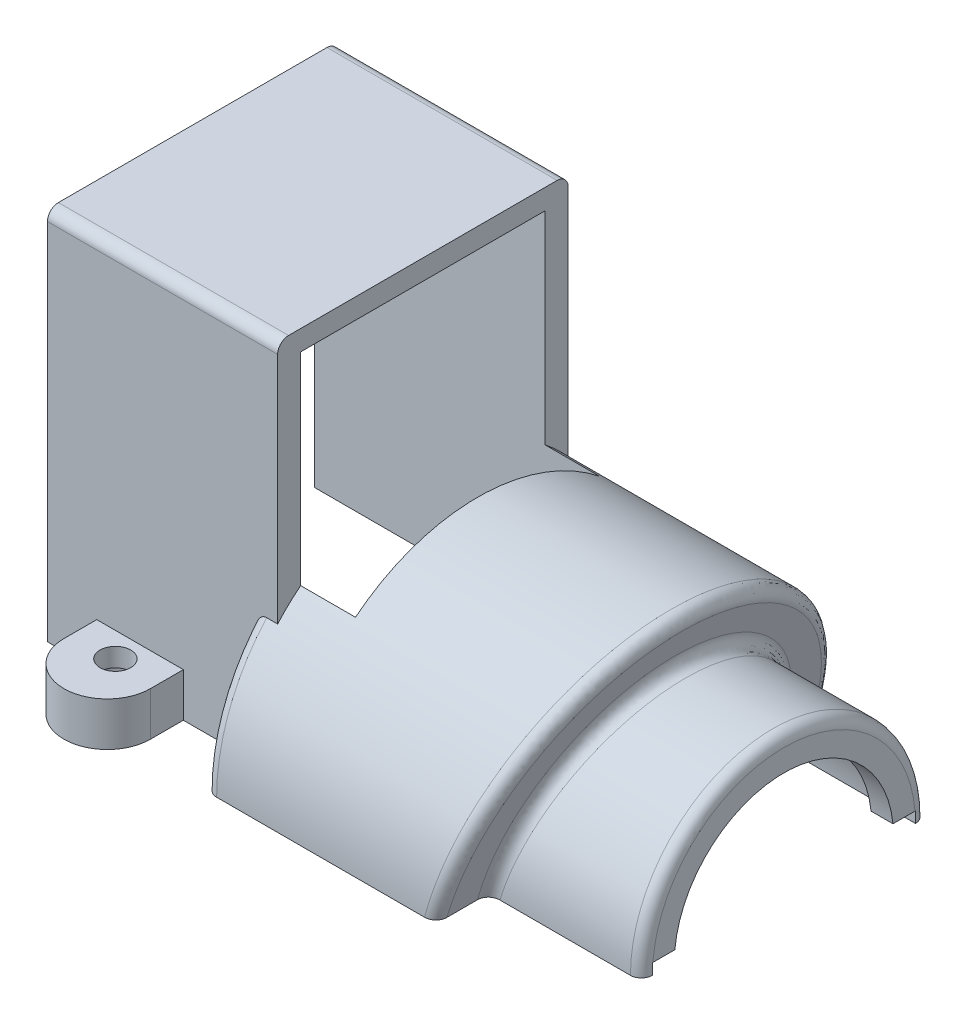
from build123d import *

# Parameters (mm, degrees)
ESQUISSE1_W                                       = 21.5
ESQUISSE1_H                                       = 34.2
EXTRUSION1_DEPTH                                  = 26.5
ESQUISSE2_W                                       = 22.27
ESQUISSE2_H                                       = 32.35
ENL_V_MAT_EXTRU_1_DEPTH                           = 49.312938226
EXTRUSION2_DEPTH                                  = 4
CHAMBRAGE_POUR_VIS_T_TE_HEXAGONALE_M2_D           = 2.8
CHAMBRAGE_POUR_VIS_T_TE_HEXAGONALE_M2_DEPTH       = 10.8185
CHAMBRAGE_POUR_VIS_T_TE_HEXAGONALE_M2_CBORE_D     = 5
CHAMBRAGE_POUR_VIS_T_TE_HEXAGONALE_M2_CBORE_DEPTH = 2.3
CHAMBRAGE_POUR_VIS_T_TE_HEXAGONALE_M2_TIP         = 0.841204867
CONG_1_R                                          = 1
EXTRUSION3_DEPTH                                  = 24
EXTRUSION3_DEPTH_BACK                             = 2
ENL_V_MAT_EXTRU_2_DEPTH                           = 24
ENL_V_MAT_EXTRU_3_DEPTH                           = 7
ENL_V_MAT_EXTRU_5_DEPTH                           = 67.021151914
ENL_V_MAT_EXTRU_5_DEPTH_BACK                      = 67.021151914
EXTRUSION4_START                                  = -1
EXTRUSION4_DEPTH                                  = 5.297752809
EXTRUSION4_START_2                                = 38.99092925
EXTRUSION4_2_OUTLINE_W                            = 19
EXTRUSION4_2_OUTLINE_H                            = 34
EXTRUSION4_2_DEPTH                                = 5.00907075
EXTRUSION5_DEPTH                                  = 13.95
ENL_V_MAT_EXTRU_6_DEPTH                           = 13.95
CONG_4_R                                          = 1
EXTRUSION7_REACH                                  = 74.48
EXTRUSION7_END_RADIUS                             = 15.3
ESQUISSE15_R                                      = 2.5
EXTRUSION7_DIRECTION_2_DEPTH                      = 1.5
ESQUISSE16_R                                      = 1.15
ENL_V_MAT_EXTRU_7_DEPTH                           = 10
EXTRUSION9_DEPTH                                  = 2
EXTRUSION11_DEPTH                                 = 2
CONG_6_R                                          = 1
ENL_V_MAT_EXTRU_10_DEPTH                          = 1
ESQUISSE20_W                                      = 1.651458657
ESQUISSE20_H                                      = 29.200791705
ENL_V_MAT_EXTRU_11_DEPTH                          = 74.199692791


with BuildPart() as part:
    # Esquisse1 → Extrusion1 (new body)
    with BuildSketch(Plane.XY):
        with Locations((10.75, 17.1)):
            Rectangle(ESQUISSE1_W, ESQUISSE1_H)
    extrude(amount=EXTRUSION1_DEPTH)

    # Esquisse2 → Enlèv. mat.-Extru.1 (cut, through all)
    with BuildSketch(Plane.ZY):
        with Locations((13.265, 16.175)):
            Rectangle(ESQUISSE2_W, ESQUISSE2_H)
    extrude(amount=-ENL_V_MAT_EXTRU_1_DEPTH, mode=Mode.SUBTRACT)

    # Esquisse3 → Extrusion2 (add)
    with BuildSketch(Plane.XZ):
        with BuildLine():
            Line((12.9, 26.5), (5, 26.5))
            Line((5, 26.5), (5, 29.5))
            ThreePointArc((5, 29.5), (8.95, 33.45), (12.9, 29.5))
            Line((12.9, 29.5), (12.9, 26.5))
        make_face()
        with BuildLine():
            Line((12.9, 0.03), (5, 0.03))
            Line((5, 0.03), (5, -2.97))
            ThreePointArc((5, -2.97), (8.95, -6.92), (12.9, -2.97))
            Line((12.9, -2.97), (12.9, 0.03))
        make_face()
    extrude(amount=-EXTRUSION2_DEPTH)

    # Chambrage pour vis à tête hexagonale M2.51
    with Locations(Plane.XZ):
        with Locations((8.95, 28.75), (8.95, -2.25)):
            CounterBoreHole(CHAMBRAGE_POUR_VIS_T_TE_HEXAGONALE_M2_D / 2, CHAMBRAGE_POUR_VIS_T_TE_HEXAGONALE_M2_CBORE_D / 2, CHAMBRAGE_POUR_VIS_T_TE_HEXAGONALE_M2_CBORE_DEPTH, depth=CHAMBRAGE_POUR_VIS_T_TE_HEXAGONALE_M2_DEPTH)
            with Locations((0, 0, -(CHAMBRAGE_POUR_VIS_T_TE_HEXAGONALE_M2_DEPTH + CHAMBRAGE_POUR_VIS_T_TE_HEXAGONALE_M2_TIP / 2))):  # 118° drill point
                Cone(0, CHAMBRAGE_POUR_VIS_T_TE_HEXAGONALE_M2_D / 2, CHAMBRAGE_POUR_VIS_T_TE_HEXAGONALE_M2_TIP, mode=Mode.SUBTRACT)

    # Congé1
    cong_1_edges = [part.edges().sort_by_distance(p)[0] for p in [
        (10.75, 34.2, 26.5),
        (10.75, 34.2, 0),
    ]]
    fillet(cong_1_edges, radius=CONG_1_R)

    # Esquisse6 → Extrusion3 (add, two sides: drawn at the far end of the back side and taken through both)
    with BuildSketch(Plane(origin=(21.5, 0, 0), x_dir=(0, 0, -1), z_dir=(1, 0, 0)).offset(-EXTRUSION3_DEPTH_BACK)):
        with BuildLine():
            Line((-31.065, 0), (4.535, 0))
            ThreePointArc((4.535, 0), (-13.265, 17.8), (-31.065, 0))
        make_face()
    extrude(amount=EXTRUSION3_DEPTH + EXTRUSION3_DEPTH_BACK)

    # Esquisse7 → Enlèv. mat.-Extru.2 (cut)
    with BuildSketch(Plane(origin=(45.5, 0, 0), x_dir=(0, 0, -1), z_dir=(1, 0, 0))):
        with BuildLine():
            Line((-28.565, 0), (2.035, 0))
            ThreePointArc((2.035, 0), (-13.265, 15.3), (-28.565, 0))
        make_face()
    extrude(amount=-ENL_V_MAT_EXTRU_2_DEPTH, mode=Mode.SUBTRACT)

    # Esquisse8 → Enlèv. mat.-Extru.3 (cut)
    with BuildSketch(Plane.ZY.offset(-19.5)):
        with BuildLine():
            Line((2.13, 13.88710823), (2.13, 0))
            Line((2.13, 0), (24.4, 0))
            Line((24.4, 0), (24.4, 13.88710823))
            ThreePointArc((24.4, 13.88710823), (13.265, 17.8), (2.13, 13.88710823))
        make_face()
    extrude(amount=-ENL_V_MAT_EXTRU_3_DEPTH, mode=Mode.SUBTRACT)

    # Esquisse10 → Enlèv. mat.-Extru.5 (cut, two sides: drawn at the far end of the back side and taken through both)
    with BuildSketch(Plane.XY.offset(-ENL_V_MAT_EXTRU_5_DEPTH_BACK)):
        Polygon((45.5, 17.8), (40.5, 0), (45.5, 0), align=None)
    extrude(amount=ENL_V_MAT_EXTRU_5_DEPTH + ENL_V_MAT_EXTRU_5_DEPTH_BACK, mode=Mode.SUBTRACT)

    # Extrusion4: read off the stored shape, not the designer's step
    # Extrusion4 outline → Extrusion4 (add)
    with BuildSketch(Plane(origin=(40.5, 0, 0), x_dir=(0, 0, -1), z_dir=(1, 0, 0)).offset(EXTRUSION4_START)):
        with BuildLine():
            Line((-28.565, 0), (-24.565, 0))
            ThreePointArc((-24.565, 0), (-13.265, 11.3), (-1.965, 0))
            Line((-1.965, 0), (2.035, 0))
            ThreePointArc((2.035, 0), (-13.265, 15.3), (-28.565, 0))
        make_face()
    extrude(amount=EXTRUSION4_DEPTH)

    # Extrusion4 2 outline → Extrusion4 2 (cut)
    with BuildSketch(Plane(origin=(0, 0, 0), x_dir=(0.270432301636311, 0.962738993825267, 0), z_dir=(0.962738993825267, -0.270432301636311, 0)).offset(EXTRUSION4_START_2)):
        with Locations((18.5, 13)):
            Rectangle(EXTRUSION4_2_OUTLINE_W, EXTRUSION4_2_OUTLINE_H)
    extrude(amount=EXTRUSION4_2_DEPTH, mode=Mode.SUBTRACT)

    # Esquisse12 → Extrusion5 (add)
    with BuildSketch(Plane(origin=(40.5, 9.905458384, 0), x_dir=(0, 0, -1), z_dir=(-1, 0, 0))):
        with BuildLine():
            Line((-26.265, 9.905458384), (-0.265, 9.905458384))
            ThreePointArc((-0.265, 9.905458384), (-13.265, -3.094541616), (-26.265, 9.905458384))
        make_face()
    extrude(amount=-EXTRUSION5_DEPTH)

    # Esquisse13 → Enlèv. mat.-Extru.6 (cut)
    with BuildSketch(Plane(origin=(54.45, 0, 0), x_dir=(0, 0, -1), z_dir=(1, 0, 0))):
        with BuildLine():
            Line((-24.265, 0), (-2.265, 0))
            ThreePointArc((-2.265, 0), (-13.265, 11), (-24.265, 0))
        make_face()
    extrude(amount=-ENL_V_MAT_EXTRU_6_DEPTH, mode=Mode.SUBTRACT)

    # Congé4
    cong_4_edges = [part.edges().sort_by_distance(p)[0] for p in [
        (19.5, 6.374048949, 29.884611909),
        (19.5, 6.353070124, -3.362642647),
    ]]
    fillet(cong_4_edges, radius=CONG_4_R)

    # Extrusion7: up to this cylinder (the profile starts inside it)
    extrusion7_end = Plane(origin=(31.65, 0, 13.265), z_dir=(1, 0, 0)) * Cylinder(EXTRUSION7_END_RADIUS, 180.56, mode=Mode.PRIVATE)
    # Esquisse15 → Extrusion7 (add, up to the surface)
    with BuildSketch(Plane.XZ, mode=Mode.PRIVATE) as extrusion7_sk1:
        with Locations(Location((31.65, 25.365, 0), (0, 0, 270))):
            Circle(ESQUISSE15_R)
    extrusion7_tool1 = extrude(extrusion7_sk1.sketch, amount=-EXTRUSION7_REACH, mode=Mode.PRIVATE) & extrusion7_end
    add(extrusion7_tool1.solids().sort_by_distance((31.65, 0, 25.365))[0])
    # Esquisse15 → Extrusion7 (add, up to the surface)
    with BuildSketch(Plane.XZ, mode=Mode.PRIVATE) as extrusion7_sk2:
        with Locations(Location((31.65, 1.165, 0), (0, 0, 270))):
            Circle(ESQUISSE15_R)
    extrusion7_tool2 = extrude(extrusion7_sk2.sketch, amount=-EXTRUSION7_REACH, mode=Mode.PRIVATE) & extrusion7_end
    add(extrusion7_tool2.solids().sort_by_distance((31.65, 0, 1.165))[0])

    # Esquisse15 → Extrusion7 direction 2 (add)
    with BuildSketch(Plane.XZ):
        with Locations(Location((31.65, 25.365, 0), (0, 0, 270))):
            Circle(ESQUISSE15_R)
        with Locations(Location((31.65, 1.165, 0), (0, 0, 270))):
            Circle(ESQUISSE15_R)
    extrude(amount=EXTRUSION7_DIRECTION_2_DEPTH)

    # Esquisse16 → Enlèv. mat.-Extru.7 (cut)
    with BuildSketch(Plane.XZ.offset(1.5)):
        with Locations(Location((31.65, 25.365, 0), (0, 0, 270))):
            Circle(ESQUISSE16_R)
        with Locations(Location((31.65, 1.165, 0), (0, 0, 270))):
            Circle(ESQUISSE16_R)
    extrude(amount=-ENL_V_MAT_EXTRU_7_DEPTH, mode=Mode.SUBTRACT)

    # Esquisse14 → Extrusion9 (add)
    with BuildSketch(Plane(origin=(54.45, 0, 0), x_dir=(0, 0, -1), z_dir=(1, 0, 0))):
        with BuildLine():
            ThreePointArc((-2.265, 0), (-13.265, 11), (-24.265, 0))
            Line((-24.265, 0), (-23.265, 0))
            ThreePointArc((-23.265, 0), (-13.265, 10), (-3.265, 0))
            Line((-3.265, 0), (-2.265, 0))
        make_face()
    extrude(amount=-EXTRUSION9_DEPTH)

    # Esquisse18 → Extrusion11 (add)
    with BuildSketch(Plane(origin=(39.5, 0, 0), x_dir=(0, 0, -1), z_dir=(1, 0, 0))):
        with BuildLine():
            Line((-3.265, 0), (-1.965, 0))
            ThreePointArc((-1.965, 0), (-13.265, 11.3), (-24.565, 0))
            Line((-24.565, 0), (-23.265, 0))
            ThreePointArc((-23.265, 0), (-13.265, 10), (-3.265, 0))
        make_face()
    extrude(amount=EXTRUSION11_DEPTH)

    # Congé6
    cong_6_edges = [part.edges().sort_by_distance(p)[0] for p in [
        (45.401286507, 17.448579966, 9.745474866),
        (44.151685393, 13, 13.265),
        (54.45, 13, 13.265),
    ]]
    fillet(cong_6_edges, radius=CONG_6_R)

    # Esquisse19 → Enlèv. mat.-Extru.10 (cut)
    with BuildSketch(Plane.XZ):
        Polygon((54.45, 1.265), (39.5, 1.265), (39.5, -3.55), (23.919264305, -3.55), (23.919264305, -2.55), (23.919264305, -1.335), (38.356428546, -1.335), (38.356428546, 4.29444057), (54.45, 4.29444057), align=None)
        Polygon((38.356428546, 22.23555943), (38.356428546, 27.865), (23.919264305, 27.865), (23.919264305, 29.08), (23.919264305, 30.08), (39.5, 30.08), (39.5, 25.265), (54.45, 25.265), (54.45, 22.23555943), align=None)
    extrude(amount=-ENL_V_MAT_EXTRU_10_DEPTH, mode=Mode.SUBTRACT)

    # Esquisse20 → Enlèv. mat.-Extru.11 (cut, through all)
    with BuildSketch(Plane(origin=(0, 34.2, 0), x_dir=(-1, 0, 0), z_dir=(0, 1, 0))):
        with Locations((0.325729329, 13.565265211)):
            Rectangle(ESQUISSE20_W, ESQUISSE20_H)
    extrude(amount=-ENL_V_MAT_EXTRU_11_DEPTH, mode=Mode.SUBTRACT)


solid = part.part
